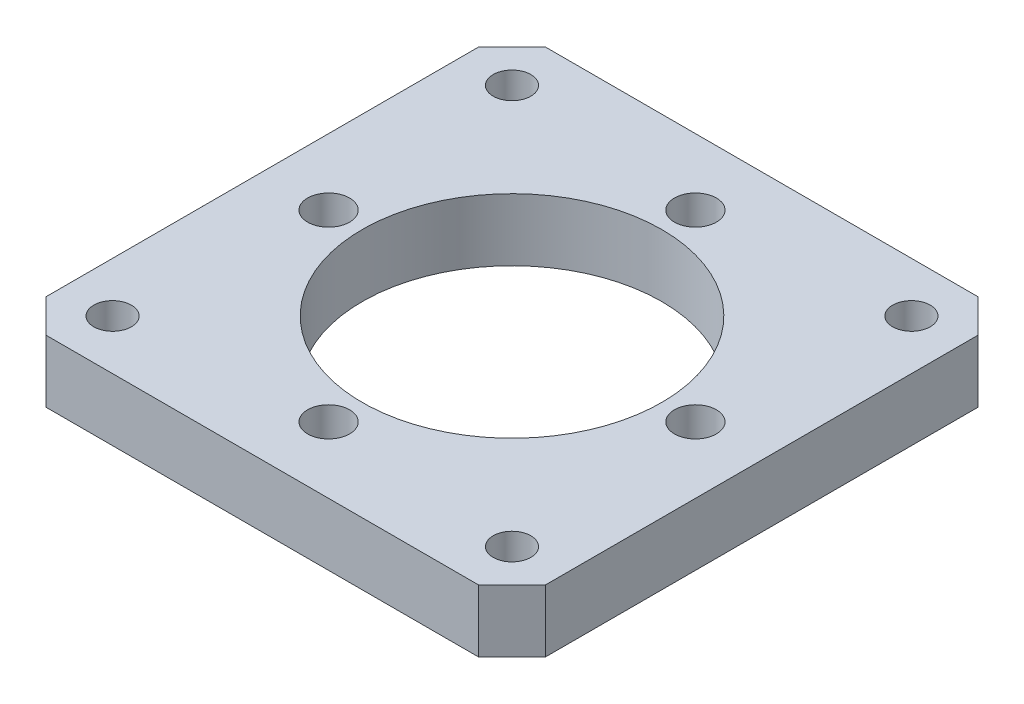
from build123d import *

# Parameters (mm, degrees)
SKETCH1_W           = 38.1
SKETCH1_H           = 38.1
SKETCH1_R           = 11.43
BOSS_EXTRUDE1_DEPTH = 4.7625
SKETCH2_R           = 1.6002
SKETCH2_R_2         = 1.4351
CUT_EXTRUDE1_DEPTH  = 28.358479604
CIRPATTERN1_COUNT   = 4
CHAMFER1_SIZE       = 2.54


with BuildPart() as part:
    # Sketch1 → Boss-Extrude1 (new body)
    with BuildSketch(Plane(origin=(0, 0, 0), x_dir=(1, 0, 0), z_dir=(0, 1, 0))):
        Rectangle(SKETCH1_W, SKETCH1_H)
        Circle(SKETCH1_R, mode=Mode.SUBTRACT)
    extrude(amount=BOSS_EXTRUDE1_DEPTH)

    # Sketch2 → Cut-Extrude1 (cut, through all)
    with BuildSketch(Plane(origin=(0, 4.7625, 0), x_dir=(1, 0, 0), z_dir=(0, 1, 0))):
        with Locations((0, 13.9954)):
            Circle(SKETCH2_R)
        with Locations((15.24, 15.24)):
            Circle(SKETCH2_R_2)
    cut_extrude1 = extrude(amount=-CUT_EXTRUDE1_DEPTH, mode=Mode.SUBTRACT)

    # CirPattern1: Cut-Extrude1 ×4 about axis
    cirpattern1_axis = Axis((0, 4.7625, 0), (0, -1, 0))
    for i in range(1, CIRPATTERN1_COUNT):
        add(cut_extrude1.rotate(cirpattern1_axis, i * 360 / CIRPATTERN1_COUNT), mode=Mode.SUBTRACT)

    # Chamfer1
    chamfer1_edges = [part.edges().sort_by_distance(p)[0] for p in [
        (-19.05, 2.38125, 19.05),
        (19.05, 2.38125, 19.05),
        (19.05, 2.38125, -19.05),
        (-19.05, 2.38125, -19.05),
    ]]
    chamfer(chamfer1_edges, length=CHAMFER1_SIZE)


solid = part.part
